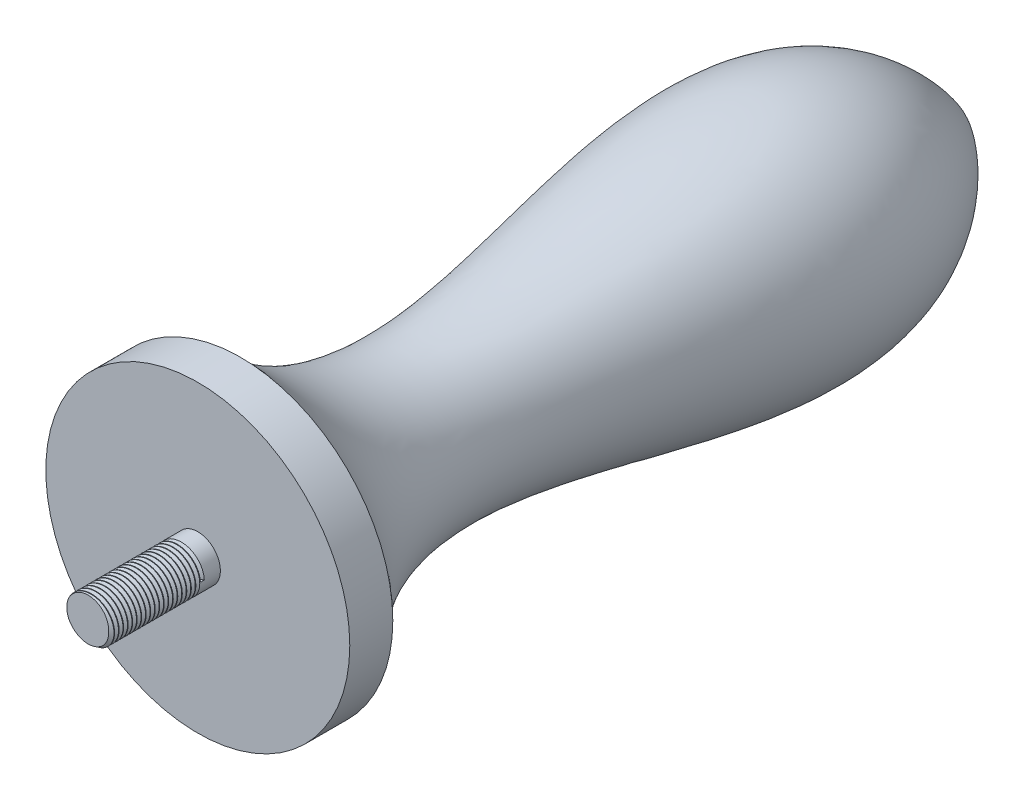
from build123d import *

# Parameters (mm, degrees)
SKETCH1_R           = 2.5
BOSS_EXTRUDE1_DEPTH = 12
CUT_SWEEP1_PITCH    = 0.5


with BuildPart() as part:
    # Sketch1 → Boss-Extrude1 (new body)
    with BuildSketch(Plane.XY):
        Circle(SKETCH1_R)
    extrude(amount=BOSS_EXTRUDE1_DEPTH)

    # Cut-Sweep1: arcs per turn and ends read off the stored shape
    # Cut-Sweep1: the profile of Sketch4 screwed along a right-hand helix through 21 turns, 6 arcs to a turn; built about Z, then put on its axis
    cut_sweep1_z = Axis((0, 0, 0), (0, 0, 1))
    cut_sweep1_corners = [(2.124275324, 0, -0.5), (2.539967517, -0.00763557, -0.260121493), (2.539967517, 0.00763557, -0.739878507)]
    with BuildLine(mode=Mode.PRIVATE) as cut_sweep1_profile:
        Line(cut_sweep1_corners[0], cut_sweep1_corners[1])
        Line(cut_sweep1_corners[1], cut_sweep1_corners[2])
        Line(cut_sweep1_corners[2], cut_sweep1_corners[0])
    cut_sweep1_cap = Face(cut_sweep1_profile.wire())
    cut_sweep1_turn_angles = [0, 30, 60, 90, 120, 150, 180, 210, 240, 270, 300, 330, 360]
    cut_sweep1_turn_weights = [1, 0.8660254037844387, 1, 0.8660254037844387, 1, 0.8660254037844387, 1, 0.8660254037844387, 1, 0.8660254037844387, 1, 0.8660254037844387, 1]
    cut_sweep1_turn_rails = [Edge.make_bspline([Vector(p[0], p[1], 0).rotate(cut_sweep1_z, cut_sweep1_turn_angles[k]) / cut_sweep1_turn_weights[k] + Vector(0, 0, p[2] + CUT_SWEEP1_PITCH * cut_sweep1_turn_angles[k] / 360) for k in range(13)], [0, 0, 0, 1, 1, 2, 2, 3, 3, 4, 4, 5, 5, 6, 6, 6], 2, cut_sweep1_turn_weights) for p in cut_sweep1_corners]
    cut_sweep1_turn_sides = [Face.make_surface_from_curves(cut_sweep1_turn_rails[p[0]], cut_sweep1_turn_rails[p[1]]) for p in [(0, 1), (1, 2), (2, 0)]]
    cut_sweep1 = Plane(origin=(0, 0, 12), x_dir=(1, 0, 0), z_dir=(0, 0, -1)) * Solid(Shell([*[p.moved(Location((0, 0, CUT_SWEEP1_PITCH * i))) for i in range(21) for p in cut_sweep1_turn_sides], cut_sweep1_cap, cut_sweep1_cap.rotate(cut_sweep1_z, 7560).moved(Location((0, 0, CUT_SWEEP1_PITCH * 7560 / 360)))]))
    add(cut_sweep1, mode=Mode.SUBTRACT)

    # Sketch2 → Revolve5 (revolve)
    with BuildSketch(Plane(origin=(0, 0, 0), x_dir=(1, 0, 0), z_dir=(0, 1, 0)), mode=Mode.PRIVATE) as revolve5_sk:
        with BuildLine():
            Line((0, 0), (-16.829625004, 0))
            Line((-16.829625004, 0), (-16.829625004, 4.765091279))
            add(Edge.make_bspline(
                [(-1.746271497, 83.7223824), (-31.214534415, 64.435626125), (7.263088854, 25.43750982), (-16.829625004, 4.765091279)],
                knots=[0, 0, 0, 0, 1, 1, 1, 1], degree=3))
            Line((-1.746271497, 83.7223824), (0, 83.7223824))
            Line((0, 83.7223824), (0, 0))
        make_face()
    revolve(revolve5_sk.sketch.rotate(Axis((0, 0, 0), (0, 0, -1)), 24.004001194), axis=Axis((0, 0, 0), (0, 0, -1)))


solid = part.part
